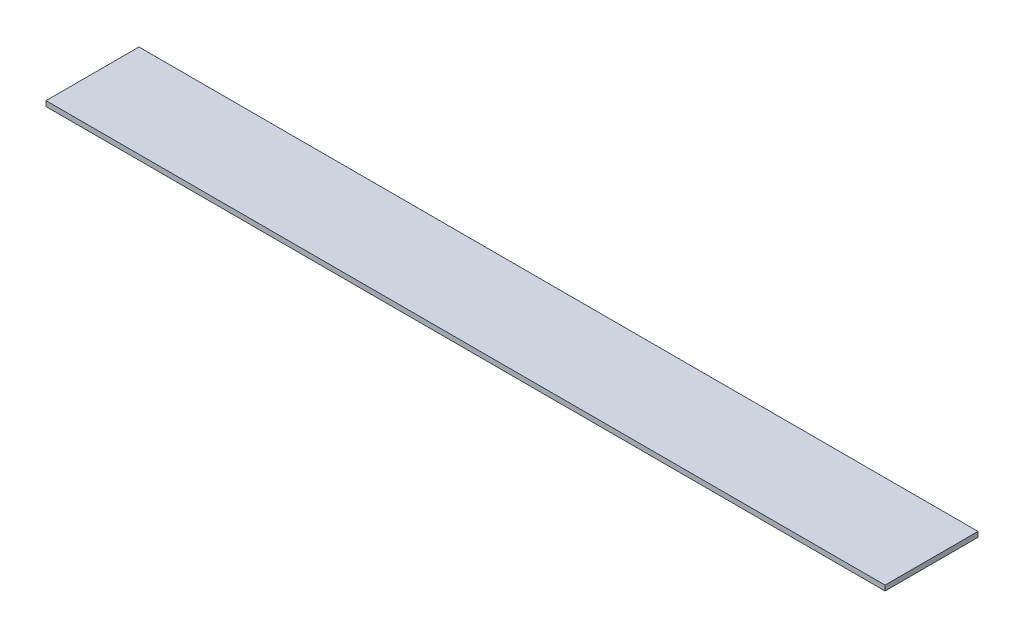
from build123d import *

# Parameters (mm, degrees)
ESBO_O1_W          = 36
ESBO_O1_H          = 2
FLANGE_BASE2_DEPTH = 162.5


# Sheet-metal steps are written as plain solids
with BuildPart() as part:
    # Esboço1 → Flange-base2 (new, symmetric)
    with BuildSketch(Plane(origin=(0, 0, 0), x_dir=(0, 0, -1), z_dir=(1, 0, 0))):
        with Locations((0, -1)):
            Rectangle(ESBO_O1_W, ESBO_O1_H)
    extrude(amount=FLANGE_BASE2_DEPTH, both=True)


solid = part.part
